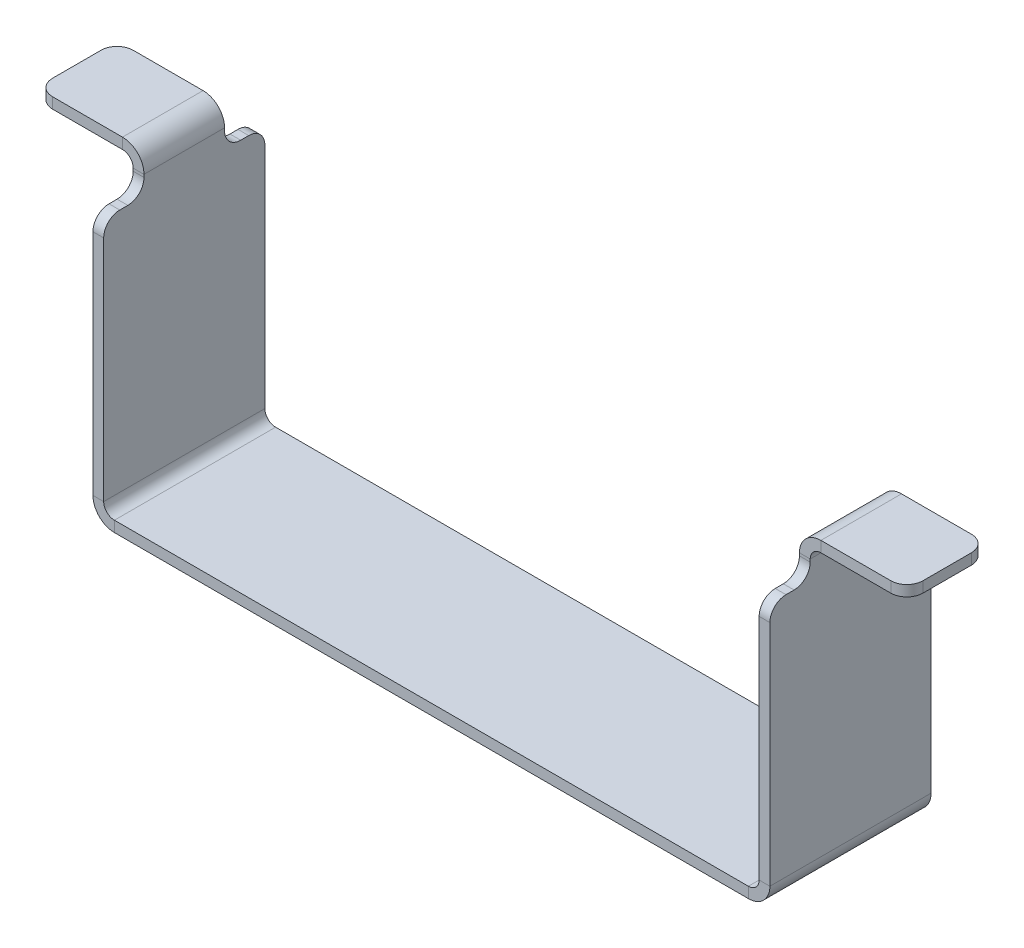
from build123d import *

# Parameters (mm, degrees)
BASE_FLANGE1_DEPTH      = 1.5
CUT_EXTRUDE1_DEPTH      = 11.017484714
CUT_EXTRUDE1_DEPTH_BACK = 11.017484714
SKETCH6_W               = 0.75
SKETCH6_H               = 3.25
FILLET1_R               = 0.3
FILLET2_R               = 0.3


# Sheet-metal steps are written as plain solids
with BuildPart() as part:
    # Sketch1 → Base-Flange1 (new, symmetric)
    with BuildSketch(Plane.XY):
        with BuildLine():
            Line((8.1, 0), (6.5, 0))
            ThreePointArc((6.5, 0), (6.217157288, -0.117157288), (6.1, -0.4))
            Line((6.1, -0.4), (6.1, -5.3))
            ThreePointArc((6.1, -5.3), (6.041421356, -5.441421356), (5.9, -5.5))
            Line((5.9, -5.5), (-5.9, -5.5))
            ThreePointArc((-5.9, -5.5), (-6.041421356, -5.441421356), (-6.1, -5.3))
            Line((-6.1, -5.3), (-6.1, -0.4))
            ThreePointArc((-6.1, -0.4), (-6.217157288, -0.117157288), (-6.5, 0))
            Line((-6.5, 0), (-8.1, 0))
            Line((-8.1, 0), (-8.1, -0.2))
            Line((-8.1, -0.2), (-6.5, -0.2))
            ThreePointArc((-6.5, -0.2), (-6.358578644, -0.258578644), (-6.3, -0.4))
            Line((-6.3, -0.4), (-6.3, -5.3))
            ThreePointArc((-6.3, -5.3), (-6.182842712, -5.582842712), (-5.9, -5.7))
            Line((-5.9, -5.7), (5.9, -5.7))
            ThreePointArc((5.9, -5.7), (6.182842712, -5.582842712), (6.3, -5.3))
            Line((6.3, -5.3), (6.3, -0.4))
            ThreePointArc((6.3, -0.4), (6.358578644, -0.258578644), (6.5, -0.2))
            Line((6.5, -0.2), (8.1, -0.2))
            Line((8.1, -0.2), (8.1, 0))
        make_face()
    extrude(amount=BASE_FLANGE1_DEPTH, both=True)

    # Sketch6 → Cut-Extrude1 (cut, two sides: drawn at the far end of the back side and taken through both)
    with BuildSketch(Plane(origin=(0, 0, 0), x_dir=(0, 0, -1), z_dir=(1, 0, 0)).offset(-CUT_EXTRUDE1_DEPTH_BACK)):
        with Locations((1.125, 0.875)):
            Rectangle(SKETCH6_W, SKETCH6_H)
        with Locations((-1.125, 0.875)):
            Rectangle(SKETCH6_W, SKETCH6_H)
    extrude(amount=CUT_EXTRUDE1_DEPTH + CUT_EXTRUDE1_DEPTH_BACK, mode=Mode.SUBTRACT)

    # Fillet1
    fillet1_edges = [part.edges().sort_by_distance(p)[0] for p in [
        (6.2, -0.75, -1.5),
        (-6.2, -0.75, -1.5),
        (6.2, -0.75, -0.75),
        (-6.2, -0.75, -0.75),
        (6.2, -0.75, 1.5),
        (-6.2, -0.75, 1.5),
        (6.2, -0.75, 0.75),
        (-6.2, -0.75, 0.75),
    ]]
    fillet(fillet1_edges, radius=FILLET1_R)

    # Fillet2
    fillet2_edges = [part.edges().sort_by_distance(p)[0] for p in [
        (-8.1, -0.1, -0.75),
        (8.1, -0.1, -0.75),
        (8.1, -0.1, 0.75),
        (-8.1, -0.1, 0.75),
    ]]
    fillet(fillet2_edges, radius=FILLET2_R)


solid = part.part
